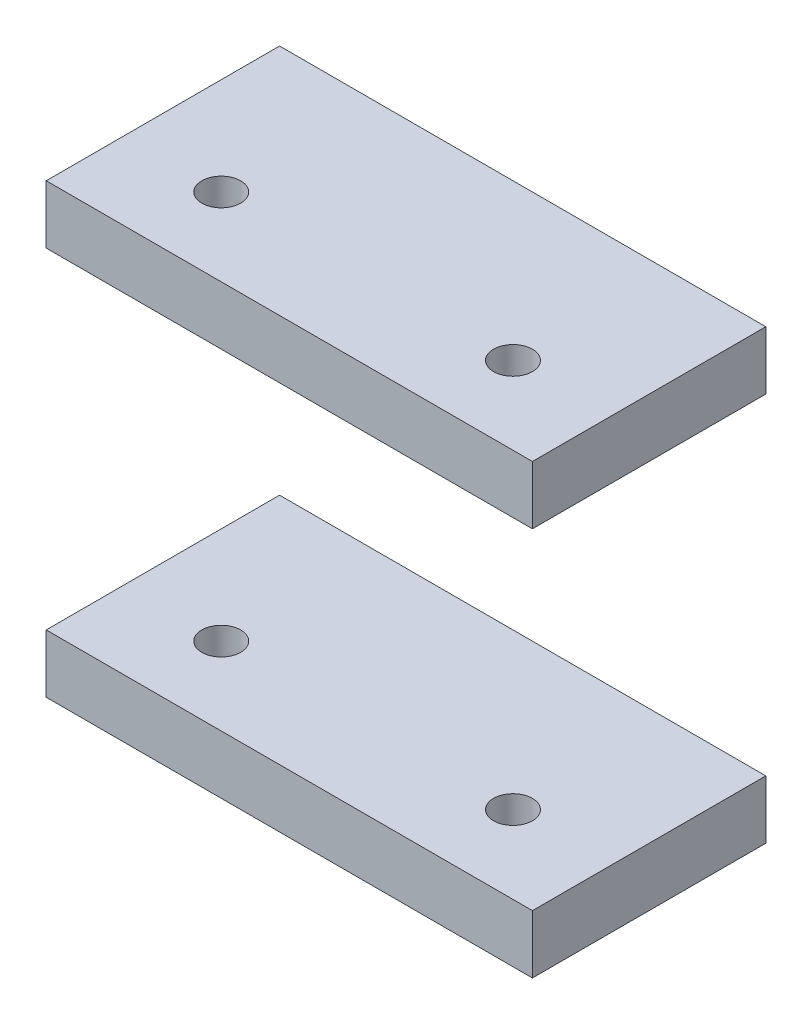
from build123d import *

# Parameters (mm, degrees)
SKETCH_1_W          = 50
SKETCH_1_H          = 6
EXTRUDE_1_DEPTH     = 24
EXTRUDE_1_2_DEPTH   = 24
SKETCH_2_R          = 2
CUT_EXTRUDE_1_DEPTH = 58.5934024


with BuildPart() as part:
    # 草图1 → 凸台-拉伸1 (new body)
    with BuildSketch(Plane.XY):
        with Locations((0, -20)):
            Rectangle(SKETCH_1_W, SKETCH_1_H)
    extrude(amount=EXTRUDE_1_DEPTH)


with BuildPart() as body_2:
    # 草图1 → Extrude 1 2 (new body)
    with BuildSketch(Plane.XY):
        with Locations((0, 20)):
            Rectangle(SKETCH_1_W, SKETCH_1_H)
    extrude(amount=EXTRUDE_1_2_DEPTH)


with BuildPart() as cut_extrude_1_tool:
    # 草图2 → 切除-拉伸1 (new, through all)
    with BuildSketch(Plane.XZ.offset(23)):
        with Locations((-15, 16)):
            Circle(SKETCH_2_R)
        with Locations((15, 16)):
            Circle(SKETCH_2_R)
    extrude(amount=-CUT_EXTRUDE_1_DEPTH)


with BuildPart() as part_1:
    add(part.part)

    # 切除-拉伸1: cut by cut_extrude_1_tool
    add(cut_extrude_1_tool.part, mode=Mode.SUBTRACT)


with BuildPart() as body_2_1:
    add(body_2.part)

    # 切除-拉伸1: cut by cut_extrude_1_tool
    add(cut_extrude_1_tool.part, mode=Mode.SUBTRACT)


solid = Compound([part_1.part, body_2_1.part])
